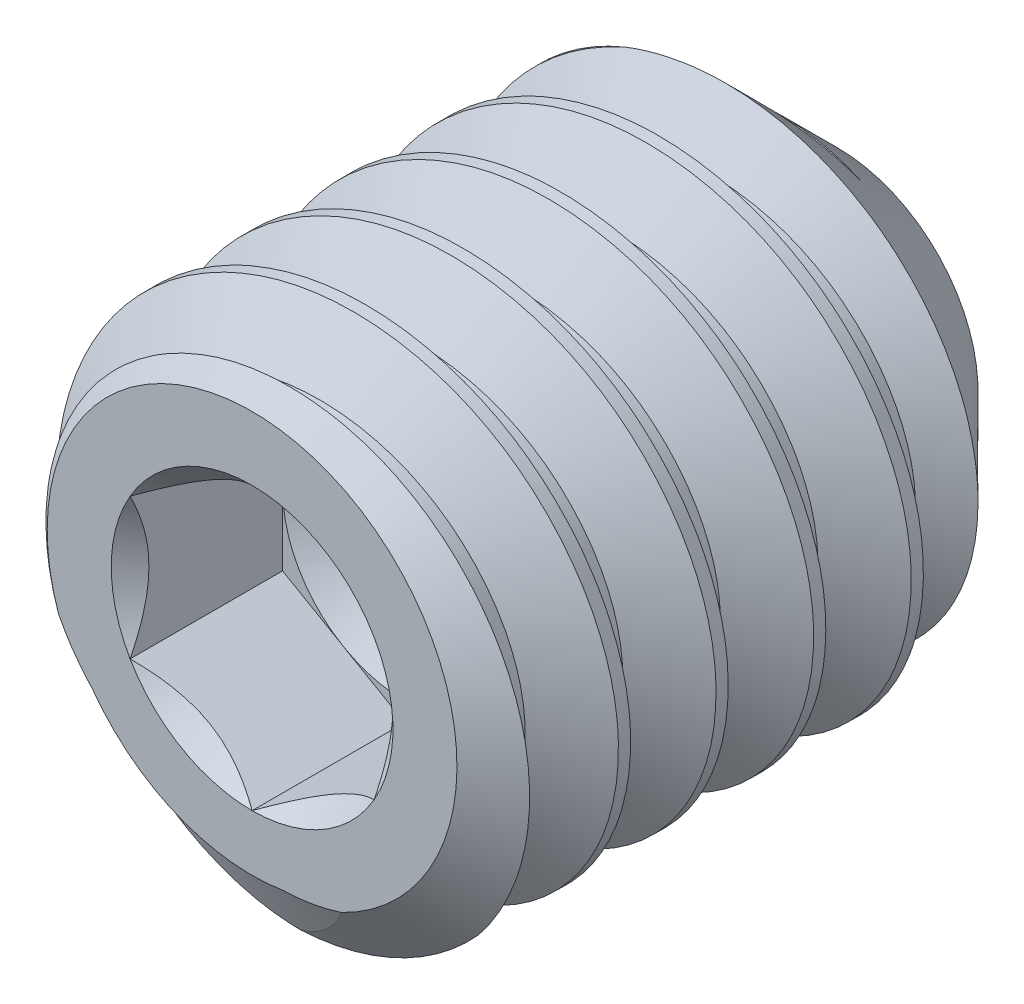
from build123d import *

# Parameters (mm, degrees)
CUT_SWEEP2_PITCH    = 0.79375
CUT_EXTRUDE10_DEPTH = 1.240234375


with BuildPart() as part:
    # Sketch22 → Revolve1 (revolve)
    with BuildSketch(Plane(origin=(0, 0, 0), x_dir=(0, 0, -1), z_dir=(1, 0, 0)), mode=Mode.PRIVATE) as revolve1_sk:
        Polygon((-2.038368495, 0), (-2.038368495, 1.66624), (-1.746690043, 2.0828), (1.782632812, 2.0828), (2.724131505, 1.141301307), (2.038368495, 0), align=None)
    revolve(revolve1_sk.sketch.rotate(Axis((0, 0, -2.038368495), (0, 0, -1)), 180), axis=Axis((0, 0, -2.038368495), (0, 0, -1)))

    # Cut-Sweep2: the profile of Sketch28 profile screwed along a right-hand helix of 7.32 turns, 8 arcs to a turn; built about Z, then put on its axis
    cut_sweep2_z = Axis((0, 0, 0), (0, 0, 1))
    cut_sweep2_corners = [(2.0831, 0, 0.000173205), (2.0831, 0, -0.694704455), (1.601614635, 0, -0.41671875), (1.601614635, 0, -0.2778125)]
    with BuildLine(mode=Mode.PRIVATE) as cut_sweep2_profile:
        Line(cut_sweep2_corners[0], cut_sweep2_corners[1])
        Line(cut_sweep2_corners[1], cut_sweep2_corners[2])
        Line(cut_sweep2_corners[2], cut_sweep2_corners[3])
        Line(cut_sweep2_corners[3], cut_sweep2_corners[0])
    cut_sweep2_cap = Face(cut_sweep2_profile.wire())
    cut_sweep2_turn_angles = [0, 22.5, 45, 67.5, 90, 112.5, 135, 157.5, 180, 202.5, 225, 247.5, 270, 292.5, 315, 337.5, 360]
    cut_sweep2_turn_weights = [1, 0.9238795325112867, 1, 0.9238795325112867, 1, 0.9238795325112867, 1, 0.9238795325112867, 1, 0.9238795325112867, 1, 0.9238795325112867, 1, 0.9238795325112867, 1, 0.9238795325112867, 1]
    cut_sweep2_turn_rails = [Edge.make_bspline([Vector(p[0], p[1], 0).rotate(cut_sweep2_z, cut_sweep2_turn_angles[k]) / cut_sweep2_turn_weights[k] + Vector(0, 0, p[2] + CUT_SWEEP2_PITCH * cut_sweep2_turn_angles[k] / 360) for k in range(17)], [0, 0, 0, 1, 1, 2, 2, 3, 3, 4, 4, 5, 5, 6, 6, 7, 7, 8, 8, 8], 2, cut_sweep2_turn_weights) for p in cut_sweep2_corners]
    cut_sweep2_turn_sides = [Face.make_surface_from_curves(cut_sweep2_turn_rails[p[0]], cut_sweep2_turn_rails[p[1]]) for p in [(0, 1), (1, 2), (2, 3), (3, 0)]]
    cut_sweep2_last_angles = [2520, 2542.5, 2565, 2587.5, 2610, 2622.6, 2635.2]
    cut_sweep2_last_weights = [1, 0.9238795325112867, 1, 0.9238795325112867, 1, 0.9759167619387451, 1]
    cut_sweep2_last_rails = [Edge.make_bspline([Vector(p[0], p[1], 0).rotate(cut_sweep2_z, cut_sweep2_last_angles[k]) / cut_sweep2_last_weights[k] + Vector(0, 0, p[2] + CUT_SWEEP2_PITCH * cut_sweep2_last_angles[k] / 360) for k in range(7)], [0, 0, 0, 1, 1, 2, 2, 3, 3, 3], 2, cut_sweep2_last_weights) for p in cut_sweep2_corners]
    cut_sweep2_last_sides = [Face.make_surface_from_curves(cut_sweep2_last_rails[p[0]], cut_sweep2_last_rails[p[1]]) for p in [(0, 1), (1, 2), (2, 3), (3, 0)]]
    cut_sweep2 = Plane(origin=(0, 0, -2.724131505), x_dir=(0, 1, 0), z_dir=(0, 0, 1)) * Solid(Shell([*[p.moved(Location((0, 0, CUT_SWEEP2_PITCH * i))) for i in range(7) for p in cut_sweep2_turn_sides], *cut_sweep2_last_sides, cut_sweep2_cap, cut_sweep2_cap.rotate(cut_sweep2_z, 2635.2).moved(Location((0, 0, CUT_SWEEP2_PITCH * 2635.2 / 360)))]))
    add(cut_sweep2, mode=Mode.SUBTRACT)

    # Sketch23 → Cut-Extrude10 (cut)
    with BuildSketch(Plane.XY.offset(2.038368495)):
        Polygon((0, 1.14567944), (-0.9921875, 0.57283972), (-0.9921875, -0.57283972), (0, -1.14567944), (0.9921875, -0.57283972), (0.9921875, 0.57283972), align=None)
    extrude(amount=-CUT_EXTRUDE10_DEPTH, mode=Mode.SUBTRACT)

    # Cut-Extrude11 cone 1 section (through the dimple's axis) → Cut-Extrude11 (revolve, cut)
    with BuildSketch(Plane(origin=(0, 0, 2.038368495), x_dir=(0, -1, 0), z_dir=(1, 0, 0))):
        Polygon((0, 0), (1.14567944, 0), (0, 1.14567944), align=None)
    revolve(axis=Axis((0, 0, 2.038368495), (0, 0, -1)), mode=Mode.SUBTRACT)

    # Cut-Extrude12 cone 1 section (through the dimple's axis) → Cut-Extrude12 (revolve, cut)
    with BuildSketch(Plane(origin=(0, 0, 0.79813412), x_dir=(0, -1, 0), z_dir=(1, 0, 0))):
        Polygon((0, 0), (0.9921875, 0), (0, 0.57283972), align=None)
    revolve(axis=Axis((0, 0, 0.79813412), (0, 0, -1)), mode=Mode.SUBTRACT)


solid = part.part
